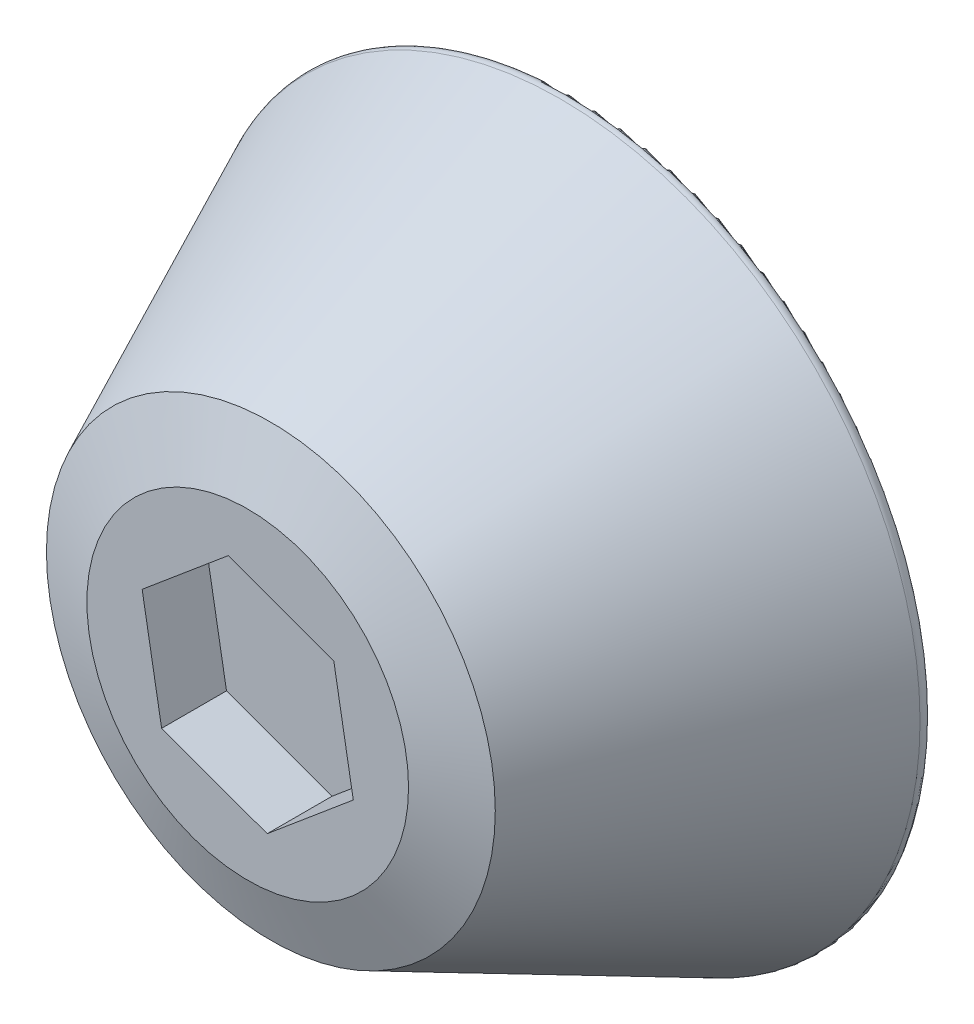
from build123d import *

# Parameters (mm, degrees)
SKETCH1_R            = 28.575
CONE_EXTRUDE_DEPTH   = 25.4
CONE_EXTRUDE_TAPER   = 25
MOTOR_AXLE_CUT_DEPTH = 15.25
CHAMFER1_SIZE        = 2
CHAMFER1_SIZE_2      = 4.134883836
CHAMFER2_SIZE        = 2
BOLT_HOLE_CUT_DEPTH  = 5.08
FILLET1_R            = 0.635


with BuildPart() as part:
    # Sketch1 → Cone Extrude (new body)
    with BuildSketch(Plane.XY):
        Circle(SKETCH1_R)
    extrude(amount=CONE_EXTRUDE_DEPTH, taper=CONE_EXTRUDE_TAPER)

    # Sketch2 → Motor Axle Cut (cut)
    with BuildSketch(Plane(origin=(0, 0, 0), x_dir=(-1, 0, 0), z_dir=(0, 0, -1))):
        with BuildLine():
            Line((-2.059884706, 2.35), (2.059884706, 2.35))
            ThreePointArc((2.059884706, 2.35), (0, -3.125), (-2.059884706, 2.35))
        make_face()
    extrude(amount=-MOTOR_AXLE_CUT_DEPTH, mode=Mode.SUBTRACT)

    # Chamfer1
    # the kernel refuses this chamfer: 4.134883836, 2 mm, written as the material it takes off along each edge
    with BuildSketch(Plane(origin=(0, 0, 25.4), x_dir=(1, 0, 0), z_dir=(0, 1, 0))) as chamfer1_piece_1:
        Polygon((16.730785483 + CHAMFER1_SIZE * 0.422618261741, CHAMFER1_SIZE * 0.906307787037), (16.730785483 - CHAMFER1_SIZE_2, 0), (16.730785483, 0), align=None)
    revolve(axis=Axis((0, 0, 25.4), (0, 0, -1)), mode=Mode.SUBTRACT)

    # Chamfer2
    chamfer2_edges = [part.edges().sort_by_distance(p)[0] for p in [
        (0, -3.125, 0),
        (0, 2.35, 0),
    ]]
    chamfer(chamfer2_edges, length=CHAMFER2_SIZE)

    # Sketch3 → Bolt Hole Cut (cut)
    with BuildSketch(Plane.XY.offset(25.4)):
        Polygon((6.741570116, 5.654240212), (-1.525930605, 8.665491088), (-8.267500721, 3.011250876), (-6.741570116, -5.654240212), (1.525930605, -8.665491088), (8.267500721, -3.011250876), align=None)
    extrude(amount=-BOLT_HOLE_CUT_DEPTH, mode=Mode.SUBTRACT)

    # Fillet1
    fillet1_edges = [part.edges().sort_by_distance(p)[0] for p in [
        (-28.575, 0, 0),
    ]]
    fillet(fillet1_edges, radius=FILLET1_R)


solid = part.part
